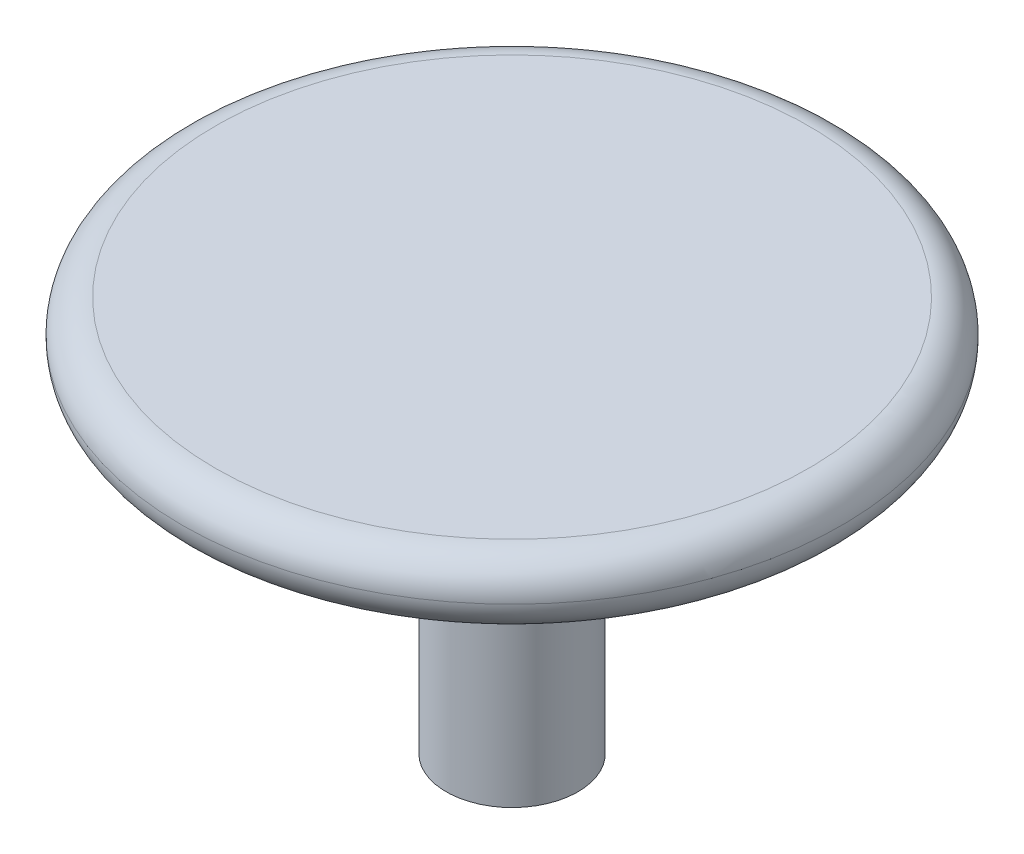
from build123d import *

# Parameters (mm, degrees)
SKETCH2_R           = 2.5
BOSS_EXTRUDE1_DEPTH = 0.5
SKETCH3_R           = 0.5
BOSS_EXTRUDE2_DEPTH = 2.5
FILLET1_R           = 0.25


with BuildPart() as part:
    # Sketch2 → Boss-Extrude1 (new body)
    with BuildSketch(Plane(origin=(0, 0, 0), x_dir=(1, 0, 0), z_dir=(0, 1, 0))):
        with Locations(Location((0, 0, 0), (0, 0, 270))):
            Circle(SKETCH2_R)
    extrude(amount=BOSS_EXTRUDE1_DEPTH)

    # Sketch3 → Boss-Extrude2 (add)
    with BuildSketch(Plane.XZ):
        with Locations(Location((0, 0, 0), (0, 0, 270))):
            Circle(SKETCH3_R)
    extrude(amount=BOSS_EXTRUDE2_DEPTH)

    # Fillet1
    fillet1_edges = [part.edges().sort_by_distance(p)[0] for p in [
        (0, 0, -2.5),
        (0, 0.5, -2.5),
    ]]
    fillet(fillet1_edges, radius=FILLET1_R - 0.0001)  # a hair under: the kernel refuses the full size


solid = part.part
